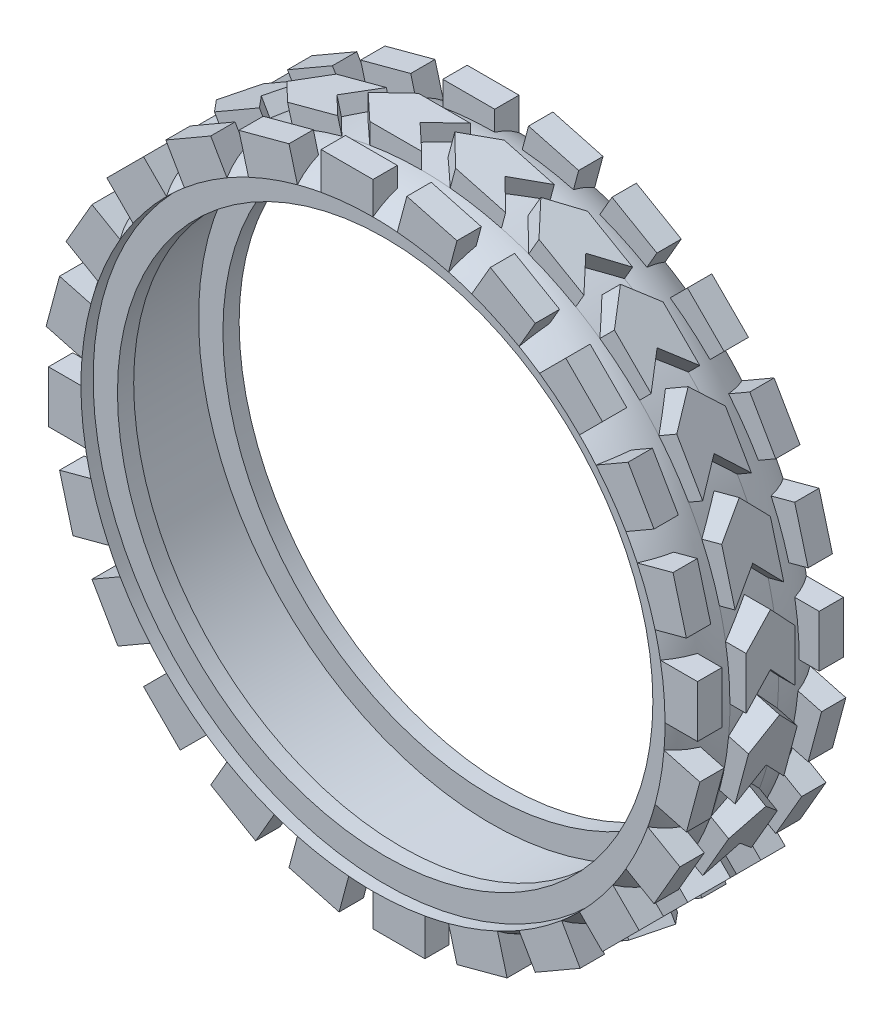
from build123d import *

# Parameters (mm, degrees)
FILLET1_R           = 10
BOSS_EXTRUDE1_REACH = 89.23
SKETCH3_W           = 2.999146453
SKETCH3_H           = 6.393982412
CIRPATTERN1_COUNT   = 24


with BuildPart() as part:
    # Sketch2 → Revolve2 (revolve)
    with BuildSketch(Plane(origin=(0, 0, 0), x_dir=(0, 0, -1), z_dir=(1, 0, 0)), mode=Mode.PRIVATE) as revolve2_sk:
        Polygon((-9, 38), (9, 38), (9, 36), (7.5, 36), (7.5, 33), (5.5, 33), (5.5, 36), (0, 36), (-5.5, 36), (-5.5, 33), (-7.5, 33), (-7.5, 36), (-9, 36), align=None)
    revolve(revolve2_sk.sketch.rotate(Axis((0, 0, 11.981896623), (0, 0, -1)), 90), axis=Axis((0, 0, 11.981896623), (0, 0, -1)))

    # Fillet1
    # the kernel refuses this fillet: 10 mm, written as the material it takes off along each edge
    with BuildSketch(Plane(origin=(0, 0, 9), x_dir=(1, 0, 0), z_dir=(0, 1, 0))) as fillet1_piece_1:
        with BuildLine():
            CenterArc((28, 6), FILLET1_R, 323.130102354, 36.869897646)
            Line((36, 0), (36.16, -0.12))
            ThreePointArc((36.16, -0.12), (37, -0.2), (38, -0.2))
            Line((38, -0.2), (38.2, 0))
            Line((38.2, 0), (38.2, 6))
            Line((38.2, 6), (38, 6))
        make_face()
    revolve(axis=Axis((0, 0, 9), (0, 0, -1)), mode=Mode.SUBTRACT)
    with BuildSketch(Plane(origin=(0, 0, -9), x_dir=(1, 0, 0), z_dir=(0, 1, 0))) as fillet1_piece_2:
        with BuildLine():
            CenterArc((28, -6), FILLET1_R, 0, 36.869897646)
            Line((36, 0), (36.16, 0.12))
            ThreePointArc((36.16, 0.12), (37, 0.2), (38, 0.2))
            Line((38, 0.2), (38.2, 0))
            Line((38.2, 0), (38.2, -6))
            Line((38.2, -6), (38, -6))
        make_face()
    revolve(axis=Axis((0, 0, -9), (0, 0, -1)), mode=Mode.SUBTRACT)

    # Sketch3 → Boss-Extrude1 (add, up to next)
    with BuildSketch(Plane(origin=(40, 0, 0), x_dir=(0, 0, -1), z_dir=(1, 0, 0)), mode=Mode.PRIVATE) as boss_extrude1_sk1:
        Polygon((-3, 0), (-3, 6.393982412), (0, 9.590973617), (3, 6.393982412), (3, 0), (0, 3.196991206), align=None)
    boss_extrude1_tool1 = extrude(boss_extrude1_sk1.sketch, amount=-BOSS_EXTRUDE1_REACH, mode=Mode.PRIVATE) - part.part
    # Sketch3 → Boss-Extrude1 (add, up to next)
    with BuildSketch(Plane(origin=(40, 0, 0), x_dir=(0, 0, -1), z_dir=(1, 0, 0)), mode=Mode.PRIVATE) as boss_extrude1_sk2:
        with Locations((-7.500426774, 3.196991206)):
            Rectangle(SKETCH3_W, SKETCH3_H)
    boss_extrude1_tool2 = extrude(boss_extrude1_sk2.sketch, amount=-BOSS_EXTRUDE1_REACH, mode=Mode.PRIVATE) - part.part
    # Sketch3 → Boss-Extrude1 (add, up to next)
    with BuildSketch(Plane(origin=(40, 0, 0), x_dir=(0, 0, -1), z_dir=(1, 0, 0)), mode=Mode.PRIVATE) as boss_extrude1_sk3:
        with Locations((7.500426774, 3.196991206)):
            Rectangle(SKETCH3_W, SKETCH3_H)
    boss_extrude1_tool3 = extrude(boss_extrude1_sk3.sketch, amount=-BOSS_EXTRUDE1_REACH, mode=Mode.PRIVATE) - part.part
    boss_extrude1_1 = boss_extrude1_tool1.solids().sort_by_distance((40, 4.795487, 0))[0]
    add(boss_extrude1_1)
    boss_extrude1_2 = boss_extrude1_tool2.solids().sort_by_distance((40, 3.196991, 7.500427))[0]
    add(boss_extrude1_2)
    boss_extrude1_3 = boss_extrude1_tool3.solids().sort_by_distance((40, 3.196991, -7.500427))[0]
    add(boss_extrude1_3)
    boss_extrude1 = boss_extrude1_1 + boss_extrude1_2 + boss_extrude1_3  # Boss-Extrude1 as one shape, for the pattern or mirror that repeats it

    # CirPattern1: Boss-Extrude1 ×24 about axis
    cirpattern1_axis = Axis((0, 0, 0), (0, 0, 1))
    for i in range(1, CIRPATTERN1_COUNT):
        add(boss_extrude1.rotate(cirpattern1_axis, i * 360 / CIRPATTERN1_COUNT))


solid = part.part
